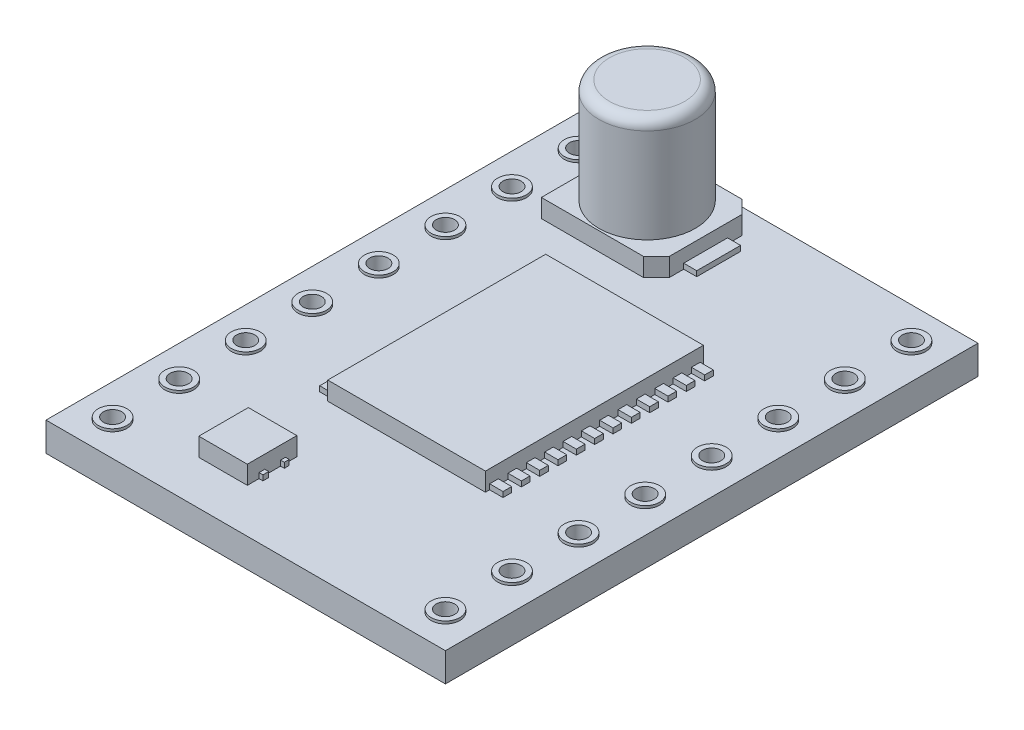
from build123d import *

# Parameters (mm, degrees)
ESBO_O1_W                     = 15.24
ESBO_O1_H                     = 20.32
RESSALTO_EXTRUS_O1_DEPTH      = 1.1
ESBO_O2_R                     = 0.35
CORTE_EXTRUS_O1_DEPTH         = 13.747548784
RESSALTO_EXTRUS_O2_DEPTH      = 1.2
RESSALTO_EXTRUS_O2_DEPTH_BACK = 0.1
ESBO_O3_R                     = 0.55
ESBO_O3_R_2                   = 0.35
ESBO_O4_W                     = 6.016877305
ESBO_O4_H                     = 8.315738712
ESBO_O4_W_2                   = 1.851570767
ESBO_O4_H_2                   = 1.890360856
RESSALTO_EXTRUS_O3_DEPTH      = 0.7
ESBO_O5_R                     = 1.839028411
RESSALTO_EXTRUS_O4_DEPTH      = 4
ESBO_O6_W                     = 0.939544633
ESBO_O6_H                     = 0.330110277
ESBO_O6_H_2                   = 0.330110276
ESBO_O6_W_2                   = 0.939544634
ESBO_O6_W_3                   = 2.123838289
ESBO_O6_H_3                   = 0.21970741
ESBO_O6_W_4                   = 2.156387534
ESBO_O6_H_4                   = 0.187905534
ESBO_O6_W_5                   = 5.329895825
ESBO_O6_H_5                   = 1.672934758
RESSALTO_EXTRUS_O5_DEPTH      = 0.2
FILETE1_R                     = 0.4


with BuildPart() as part:
    # Esboço1 → Ressalto-extrusão1 (new body)
    with BuildSketch(Plane(origin=(0, 0, 0), x_dir=(1, 0, 0), z_dir=(0, 1, 0))):
        Rectangle(ESBO_O1_W, ESBO_O1_H)
    extrude(amount=RESSALTO_EXTRUS_O1_DEPTH)

    # Esboço2 → Corte-extrusão1 (cut, through all)
    with BuildSketch(Plane(origin=(0, 1.1, 0), x_dir=(1, 0, 0), z_dir=(0, 1, 0))):
        with Locations((-6.35, 8.89)):
            Circle(ESBO_O2_R)
        with Locations((-6.35, 6.35)):
            Circle(ESBO_O2_R)
        with Locations((-6.35, 3.81)):
            Circle(ESBO_O2_R)
        with Locations((-6.35, 1.27)):
            Circle(ESBO_O2_R)
        with Locations((-6.35, -1.27)):
            Circle(ESBO_O2_R)
        with Locations((-6.35, -3.81)):
            Circle(ESBO_O2_R)
        with Locations((-6.35, -6.35)):
            Circle(ESBO_O2_R)
        with Locations((-6.35, -8.89)):
            Circle(ESBO_O2_R)
        with Locations((6.35, -8.89)):
            Circle(ESBO_O2_R)
        with Locations((6.35, -6.35)):
            Circle(ESBO_O2_R)
        with Locations((6.35, -3.81)):
            Circle(ESBO_O2_R)
        with Locations((6.35, -1.27)):
            Circle(ESBO_O2_R)
        with Locations((6.35, 1.27)):
            Circle(ESBO_O2_R)
        with Locations((6.35, 3.81)):
            Circle(ESBO_O2_R)
        with Locations((6.35, 6.35)):
            Circle(ESBO_O2_R)
        with Locations((6.35, 8.89)):
            Circle(ESBO_O2_R)
    extrude(amount=-CORTE_EXTRUS_O1_DEPTH, mode=Mode.SUBTRACT)

    # Esboço3 → Ressalto-extrusão2 (add, two sides: drawn at the far end of the back side and taken through both)
    # profile 1 of 16: a face of its own
    with BuildSketch(Plane(origin=(0, 1.1, -1.1), x_dir=(1, 0, 0), z_dir=(0, -1, 0)).offset(-RESSALTO_EXTRUS_O2_DEPTH_BACK)):
        with Locations((-6.35, 9.99)):
            Circle(ESBO_O3_R)
        with Locations((-6.35, 9.99)):
            Circle(ESBO_O3_R_2, mode=Mode.SUBTRACT)
    # profile 2 of 16: a face of its own
    with BuildSketch(Plane(origin=(0, 1.1, -1.1), x_dir=(1, 0, 0), z_dir=(0, -1, 0)).offset(-RESSALTO_EXTRUS_O2_DEPTH_BACK)):
        with Locations((-6.35, 7.45)):
            Circle(ESBO_O3_R)
        with Locations((-6.35, 7.45)):
            Circle(ESBO_O3_R_2, mode=Mode.SUBTRACT)
    # profile 3 of 16: a face of its own
    with BuildSketch(Plane(origin=(0, 1.1, -1.1), x_dir=(1, 0, 0), z_dir=(0, -1, 0)).offset(-RESSALTO_EXTRUS_O2_DEPTH_BACK)):
        with Locations((-6.35, 4.91)):
            Circle(ESBO_O3_R)
        with Locations((-6.35, 4.91)):
            Circle(ESBO_O3_R_2, mode=Mode.SUBTRACT)
    # profile 4 of 16: a face of its own
    with BuildSketch(Plane(origin=(0, 1.1, -1.1), x_dir=(1, 0, 0), z_dir=(0, -1, 0)).offset(-RESSALTO_EXTRUS_O2_DEPTH_BACK)):
        with Locations((-6.35, 2.37)):
            Circle(ESBO_O3_R)
        with Locations((-6.35, 2.37)):
            Circle(ESBO_O3_R_2, mode=Mode.SUBTRACT)
    # profile 5 of 16: a face of its own
    with BuildSketch(Plane(origin=(0, 1.1, -1.1), x_dir=(1, 0, 0), z_dir=(0, -1, 0)).offset(-RESSALTO_EXTRUS_O2_DEPTH_BACK)):
        with Locations((-6.35, -0.17)):
            Circle(ESBO_O3_R)
        with Locations((-6.35, -0.17)):
            Circle(ESBO_O3_R_2, mode=Mode.SUBTRACT)
    # profile 6 of 16: a face of its own
    with BuildSketch(Plane(origin=(0, 1.1, -1.1), x_dir=(1, 0, 0), z_dir=(0, -1, 0)).offset(-RESSALTO_EXTRUS_O2_DEPTH_BACK)):
        with Locations((-6.35, -2.71)):
            Circle(ESBO_O3_R)
        with Locations((-6.35, -2.71)):
            Circle(ESBO_O3_R_2, mode=Mode.SUBTRACT)
    # profile 7 of 16: a face of its own
    with BuildSketch(Plane(origin=(0, 1.1, -1.1), x_dir=(1, 0, 0), z_dir=(0, -1, 0)).offset(-RESSALTO_EXTRUS_O2_DEPTH_BACK)):
        with Locations((-6.35, -5.25)):
            Circle(ESBO_O3_R)
        with Locations((-6.35, -5.25)):
            Circle(ESBO_O3_R_2, mode=Mode.SUBTRACT)
    # profile 8 of 16: a face of its own
    with BuildSketch(Plane(origin=(0, 1.1, -1.1), x_dir=(1, 0, 0), z_dir=(0, -1, 0)).offset(-RESSALTO_EXTRUS_O2_DEPTH_BACK)):
        with Locations((-6.35, -7.79)):
            Circle(ESBO_O3_R)
        with Locations((-6.35, -7.79)):
            Circle(ESBO_O3_R_2, mode=Mode.SUBTRACT)
    # profile 9 of 16: a face of its own
    with BuildSketch(Plane(origin=(0, 1.1, -1.1), x_dir=(1, 0, 0), z_dir=(0, -1, 0)).offset(-RESSALTO_EXTRUS_O2_DEPTH_BACK)):
        with Locations((6.35, -7.79)):
            Circle(ESBO_O3_R)
        with Locations((6.35, -7.79)):
            Circle(ESBO_O3_R_2, mode=Mode.SUBTRACT)
    # profile 10 of 16: a face of its own
    with BuildSketch(Plane(origin=(0, 1.1, -1.1), x_dir=(1, 0, 0), z_dir=(0, -1, 0)).offset(-RESSALTO_EXTRUS_O2_DEPTH_BACK)):
        with Locations((6.35, -5.25)):
            Circle(ESBO_O3_R)
        with Locations((6.35, -5.25)):
            Circle(ESBO_O3_R_2, mode=Mode.SUBTRACT)
    # profile 11 of 16: a face of its own
    with BuildSketch(Plane(origin=(0, 1.1, -1.1), x_dir=(1, 0, 0), z_dir=(0, -1, 0)).offset(-RESSALTO_EXTRUS_O2_DEPTH_BACK)):
        with Locations((6.35, -2.71)):
            Circle(ESBO_O3_R)
        with Locations((6.35, -2.71)):
            Circle(ESBO_O3_R_2, mode=Mode.SUBTRACT)
    # profile 12 of 16: a face of its own
    with BuildSketch(Plane(origin=(0, 1.1, -1.1), x_dir=(1, 0, 0), z_dir=(0, -1, 0)).offset(-RESSALTO_EXTRUS_O2_DEPTH_BACK)):
        with Locations((6.35, -0.17)):
            Circle(ESBO_O3_R)
        with Locations((6.35, -0.17)):
            Circle(ESBO_O3_R_2, mode=Mode.SUBTRACT)
    # profile 13 of 16: a face of its own
    with BuildSketch(Plane(origin=(0, 1.1, -1.1), x_dir=(1, 0, 0), z_dir=(0, -1, 0)).offset(-RESSALTO_EXTRUS_O2_DEPTH_BACK)):
        with Locations((6.35, 2.37)):
            Circle(ESBO_O3_R)
        with Locations((6.35, 2.37)):
            Circle(ESBO_O3_R_2, mode=Mode.SUBTRACT)
    # profile 14 of 16: a face of its own
    with BuildSketch(Plane(origin=(0, 1.1, -1.1), x_dir=(1, 0, 0), z_dir=(0, -1, 0)).offset(-RESSALTO_EXTRUS_O2_DEPTH_BACK)):
        with Locations((6.35, 4.91)):
            Circle(ESBO_O3_R)
        with Locations((6.35, 4.91)):
            Circle(ESBO_O3_R_2, mode=Mode.SUBTRACT)
    # profile 15 of 16: a face of its own
    with BuildSketch(Plane(origin=(0, 1.1, -1.1), x_dir=(1, 0, 0), z_dir=(0, -1, 0)).offset(-RESSALTO_EXTRUS_O2_DEPTH_BACK)):
        with Locations((6.35, 7.45)):
            Circle(ESBO_O3_R)
        with Locations((6.35, 7.45)):
            Circle(ESBO_O3_R_2, mode=Mode.SUBTRACT)
    # profile 16 of 16: a face of its own
    with BuildSketch(Plane(origin=(0, 1.1, -1.1), x_dir=(1, 0, 0), z_dir=(0, -1, 0)).offset(-RESSALTO_EXTRUS_O2_DEPTH_BACK)):
        with Locations((6.35, 9.99)):
            Circle(ESBO_O3_R)
        with Locations((6.35, 9.99)):
            Circle(ESBO_O3_R_2, mode=Mode.SUBTRACT)
    extrude(amount=RESSALTO_EXTRUS_O2_DEPTH + RESSALTO_EXTRUS_O2_DEPTH_BACK)

    # Esboço4 → Ressalto-extrusão3 (add)
    with BuildSketch(Plane(origin=(0, 1.1, 0), x_dir=(1, 0, 0), z_dir=(0, 1, 0))):
        Polygon((-0.938225059, 5.946695044), (-0.438225059, 6.446695044), (-0.438225059, 9.214866627), (-0.938225059, 9.714866627), (-4.826637945, 9.714866627), (-4.826637945, 5.946695044), align=None)
        with Locations((0.14088325, -0.004643244)):
            Rectangle(ESBO_O4_W, ESBO_O4_H)
        with Locations((-2.547451311, -7.531814619)):
            Rectangle(ESBO_O4_W_2, ESBO_O4_H_2)
    extrude(amount=RESSALTO_EXTRUS_O3_DEPTH)

    # Esboço5 → Ressalto-extrusão4 (add)
    with BuildSketch(Plane(origin=(0, 1.8, 0), x_dir=(1, 0, 0), z_dir=(0, 1, 0))):
        with Locations((-2.704364959, 7.859163895)):
            Circle(ESBO_O5_R)
    extrude(amount=RESSALTO_EXTRUS_O4_DEPTH)

    # Esboço6 → Ressalto-extrusão5 (add)
    with BuildSketch(Plane(origin=(0, 1.1, 0), x_dir=(1, 0, 0), z_dir=(0, 1, 0))):
        with Locations((-2.868789384, 3.159751212)):
            Rectangle(ESBO_O6_W, ESBO_O6_H)
        with Locations((-2.869420097, 3.859750928)):
            Rectangle(ESBO_O6_W, ESBO_O6_H)
        with Locations((-2.86815867, 2.459751496)):
            Rectangle(ESBO_O6_W, ESBO_O6_H_2)
        with Locations((-2.867527955, 1.75975178)):
            Rectangle(ESBO_O6_W, ESBO_O6_H_2)
        with Locations((-2.866897242, 1.059752065)):
            Rectangle(ESBO_O6_W, ESBO_O6_H)
        with Locations((-2.866266528, 0.359752349)):
            Rectangle(ESBO_O6_W, ESBO_O6_H)
        with Locations((-2.865635813, -0.340247368)):
            Rectangle(ESBO_O6_W, ESBO_O6_H)
        with Locations((-2.8650051, -1.040247084)):
            Rectangle(ESBO_O6_W, ESBO_O6_H)
        with Locations((-2.864374386, -1.740246799)):
            Rectangle(ESBO_O6_W, ESBO_O6_H)
        with Locations((-2.863743671, -2.440246515)):
            Rectangle(ESBO_O6_W, ESBO_O6_H_2)
        with Locations((-2.863112958, -3.140246231)):
            Rectangle(ESBO_O6_W, ESBO_O6_H_2)
        with Locations((-2.862482244, -3.840245947)):
            Rectangle(ESBO_O6_W, ESBO_O6_H)
        with Locations((3.183995612, 3.162695271)):
            Rectangle(ESBO_O6_W_2, ESBO_O6_H)
        with Locations((3.183364898, 3.862694987)):
            Rectangle(ESBO_O6_W_2, ESBO_O6_H)
        with Locations((3.184626326, 2.462695555)):
            Rectangle(ESBO_O6_W_2, ESBO_O6_H)
        with Locations((3.18525704, 1.762695839)):
            Rectangle(ESBO_O6_W_2, ESBO_O6_H)
        with Locations((3.185887754, 1.062696123)):
            Rectangle(ESBO_O6_W_2, ESBO_O6_H_2)
        with Locations((3.186518468, 0.362696407)):
            Rectangle(ESBO_O6_W_2, ESBO_O6_H_2)
        with Locations((3.187149182, -0.337303309)):
            Rectangle(ESBO_O6_W_2, ESBO_O6_H)
        with Locations((3.187779896, -1.037303024)):
            Rectangle(ESBO_O6_W_2, ESBO_O6_H)
        with Locations((3.18841061, -1.737302741)):
            Rectangle(ESBO_O6_W_2, ESBO_O6_H)
        with Locations((3.189041324, -2.437302457)):
            Rectangle(ESBO_O6_W_2, ESBO_O6_H)
        with Locations((3.189672038, -3.137302173)):
            Rectangle(ESBO_O6_W_2, ESBO_O6_H)
        with Locations((3.190302752, -3.837301888)):
            Rectangle(ESBO_O6_W_2, ESBO_O6_H_2)
        with Locations((-2.533264404, -7.92111194)):
            Rectangle(ESBO_O6_W_3, ESBO_O6_H_3)
        with Locations((-2.557676338, -7.115144421)):
            Rectangle(ESBO_O6_W_4, ESBO_O6_H_4)
        with Locations((-2.606589724, 7.826023477)):
            Rectangle(ESBO_O6_W_5, ESBO_O6_H_5)
    extrude(amount=RESSALTO_EXTRUS_O5_DEPTH)

    # Filete1
    filete1_edges = [part.edges().sort_by_distance(p)[0] for p in [
        (-4.54339337, 5.8, -7.859163895),
    ]]
    fillet(filete1_edges, radius=FILETE1_R)


solid = part.part
